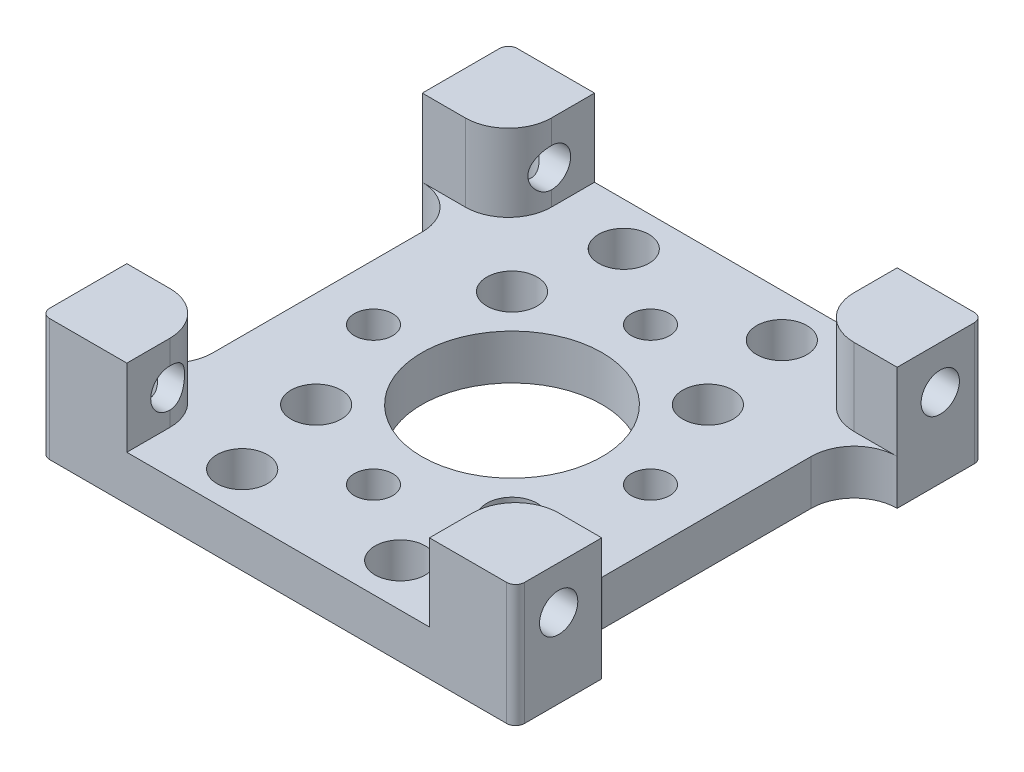
from build123d import *

# Parameters (mm, degrees)
SKETCH1_W                   = 33.528
SKETCH1_H                   = 33.02
BOSS_EXTRUDE1_DEPTH         = 3.175
CUT_EXTRUDE1_DEPTH          = 24.742207585
CUT_EXTRUDE2_DEPTH          = 24.742207585
SKETCH4_W                   = 6.08076
SKETCH4_H                   = 5.45338
BOSS_EXTRUDE2_DEPTH         = 6.08076
SKETCH5_W                   = 6.08076
SKETCH5_H                   = 5.45338
BOSS_EXTRUDE3_DEPTH         = 6.08076
SKETCH6_W                   = 6.08076
SKETCH6_H                   = 5.45338
BOSS_EXTRUDE4_DEPTH         = 6.08076
SKETCH7_W                   = 6.08076
SKETCH7_H                   = 5.45338
BOSS_EXTRUDE5_DEPTH         = 6.08076
HOLE1_D                     = 12.7254
M2_5_CLEARANCE_HOLE1_D      = 2.7051
M3_CLEARANCE_HOLE1_D        = 3.556
M2_5_CLEARANCE_HOLE2_D      = 2.7051
M2_5_CLEARANCE_HOLE2_DEPTH  = 39.60876
M2_5_CLEARANCE_HOLE3_D      = 2.7051
M2_5_CLEARANCE_HOLE3_DEPTH  = 39.60876
M2_5_CLEARANCE_HOLE4_REACH  = 27.061
M2_5_CLEARANCE_HOLE4_BORE_R = 1.35255
FILLET1_R                   = 0.635
FILLET2_R                   = 3.04038


with BuildPart() as part:
    # Sketch1 → Boss-Extrude1 (new body)
    with BuildSketch(Plane(origin=(0, 3.175, 0), x_dir=(1, 0, 0), z_dir=(0, 1, 0))):
        Rectangle(SKETCH1_W, SKETCH1_H)
    extrude(amount=-BOSS_EXTRUDE1_DEPTH)

    # Sketch2 → Cut-Extrude1 (cut, through all)
    with BuildSketch(Plane.XZ):
        with BuildLine():
            Line((16.764, -10.42924), (16.764, 10.42924))
            ThreePointArc((16.764, 10.42924), (14.617411383, 9.536940757), (13.7287, 7.388864244))
            Line((13.7287, 7.388864244), (13.7287, -7.388864244))
            ThreePointArc((13.7287, -7.388864244), (14.617411383, -9.536940757), (16.764, -10.42924))
        make_face()
    extrude(amount=-CUT_EXTRUDE1_DEPTH, mode=Mode.SUBTRACT)

    # Sketch3 → Cut-Extrude2 (cut, through all)
    with BuildSketch(Plane.XZ):
        with BuildLine():
            Line((-16.764, 10.42924), (-16.764, -10.42924))
            ThreePointArc((-16.764, -10.42924), (-14.617411383, -9.536940757), (-13.7287, -7.388864244))
            Line((-13.7287, -7.388864244), (-13.7287, 7.388864244))
            ThreePointArc((-13.7287, 7.388864244), (-14.617411383, 9.536940757), (-16.764, 10.42924))
        make_face()
    extrude(amount=-CUT_EXTRUDE2_DEPTH, mode=Mode.SUBTRACT)

    # Sketch4 → Boss-Extrude2 (add)
    with BuildSketch(Plane(origin=(0, 0, -16.51), x_dir=(-1, 0, 0), z_dir=(0, 0, -1))):
        with Locations((13.72362, 5.90169)):
            Rectangle(SKETCH4_W, SKETCH4_H)
    extrude(amount=-BOSS_EXTRUDE2_DEPTH)

    # Sketch5 → Boss-Extrude3 (add)
    with BuildSketch(Plane(origin=(0, 0, -16.51), x_dir=(-1, 0, 0), z_dir=(0, 0, -1))):
        with Locations((-13.72362, 5.90169)):
            Rectangle(SKETCH5_W, SKETCH5_H)
    extrude(amount=-BOSS_EXTRUDE3_DEPTH)

    # Sketch6 → Boss-Extrude4 (add)
    with BuildSketch(Plane.XY.offset(16.51)):
        with Locations((13.72362, 5.90169)):
            Rectangle(SKETCH6_W, SKETCH6_H)
    extrude(amount=-BOSS_EXTRUDE4_DEPTH)

    # Sketch7 → Boss-Extrude5 (add)
    with BuildSketch(Plane.XY.offset(16.51)):
        with Locations((-13.72362, 5.90169)):
            Rectangle(SKETCH7_W, SKETCH7_H)
    extrude(amount=-BOSS_EXTRUDE5_DEPTH)

    # Hole1 (through all)
    with Locations(Plane(origin=(0, 3.175, 0), x_dir=(1, 0, 0), z_dir=(0, 1, 0))):
        with Locations((0, 0)):
            Hole(HOLE1_D / 2)

    # M2.5 Clearance Hole1 (through all)
    with Locations(Plane(origin=(0, 3.175, 0), x_dir=(1, 0, 0), z_dir=(0, 1, 0))):
        with Locations((0, 9.779), (-9.779, 0), (0, -9.779), (9.779, 0)):
            Hole(M2_5_CLEARANCE_HOLE1_D / 2)

    # M3 Clearance Hole1 (through all)
    with Locations(Plane(origin=(0, 3.175, 0), x_dir=(1, 0, 0), z_dir=(0, 1, 0))):
        with Locations((-5.579615818, -13.470384182), (5.579615818, -13.470384182), (5.579615818, 13.470384182), (-5.579615818, 13.470384182), (6.914797213, 6.914797213), (-6.914797213, 6.914797213), (-6.914797213, -6.914797213), (6.914797213, -6.914797213)):
            Hole(M3_CLEARANCE_HOLE1_D / 2)

    # M2.5 Clearance Hole2
    with Locations(Plane(origin=(16.764, 0, 0), x_dir=(0, 0, -1), z_dir=(1, 0, 0))):
        with Locations((-13.470384182, 5.588)):
            Hole(M2_5_CLEARANCE_HOLE2_D / 2, depth=M2_5_CLEARANCE_HOLE2_DEPTH)

    # M2.5 Clearance Hole3
    with Locations(Plane.ZY.offset(16.764)):
        with Locations((-13.470384182, 5.588)):
            Hole(M2_5_CLEARANCE_HOLE3_D / 2, depth=M2_5_CLEARANCE_HOLE3_DEPTH)

    # M2.5 Clearance Hole4 bore → M2.5 Clearance Hole4 (cut, up to next)
    with BuildSketch(Plane(origin=(0, 0, 0), x_dir=(-1, 0, 0), z_dir=(0, -1, 0)), mode=Mode.PRIVATE) as m2_5_clearance_hole4_sk1:
        with Locations((13.470384182, 13.470384182)):
            Circle(M2_5_CLEARANCE_HOLE4_BORE_R)
    m2_5_clearance_hole4_tool1 = extrude(m2_5_clearance_hole4_sk1.sketch, amount=-M2_5_CLEARANCE_HOLE4_REACH, mode=Mode.PRIVATE) & part.part
    # M2.5 Clearance Hole4 bore → M2.5 Clearance Hole4 (cut, up to next)
    with BuildSketch(Plane(origin=(0, 0, 0), x_dir=(-1, 0, 0), z_dir=(0, -1, 0)), mode=Mode.PRIVATE) as m2_5_clearance_hole4_sk2:
        with Locations((-13.470384182, 13.470384182)):
            Circle(M2_5_CLEARANCE_HOLE4_BORE_R)
    m2_5_clearance_hole4_tool2 = extrude(m2_5_clearance_hole4_sk2.sketch, amount=-M2_5_CLEARANCE_HOLE4_REACH, mode=Mode.PRIVATE) & part.part
    # M2.5 Clearance Hole4 bore → M2.5 Clearance Hole4 (cut, up to next)
    with BuildSketch(Plane(origin=(0, 0, 0), x_dir=(-1, 0, 0), z_dir=(0, -1, 0)), mode=Mode.PRIVATE) as m2_5_clearance_hole4_sk3:
        with Locations((-13.470384182, -13.470384182)):
            Circle(M2_5_CLEARANCE_HOLE4_BORE_R)
    m2_5_clearance_hole4_tool3 = extrude(m2_5_clearance_hole4_sk3.sketch, amount=-M2_5_CLEARANCE_HOLE4_REACH, mode=Mode.PRIVATE) & part.part
    # M2.5 Clearance Hole4 bore → M2.5 Clearance Hole4 (cut, up to next)
    with BuildSketch(Plane(origin=(0, 0, 0), x_dir=(-1, 0, 0), z_dir=(0, -1, 0)), mode=Mode.PRIVATE) as m2_5_clearance_hole4_sk4:
        with Locations((13.470384182, -13.470384182)):
            Circle(M2_5_CLEARANCE_HOLE4_BORE_R)
    m2_5_clearance_hole4_tool4 = extrude(m2_5_clearance_hole4_sk4.sketch, amount=-M2_5_CLEARANCE_HOLE4_REACH, mode=Mode.PRIVATE) & part.part
    add(m2_5_clearance_hole4_tool1.solids().sort_by_distance((-13.470384, 0, -13.470384))[0], mode=Mode.SUBTRACT)
    add(m2_5_clearance_hole4_tool2.solids().sort_by_distance((13.470384, 0, -13.470384))[0], mode=Mode.SUBTRACT)
    add(m2_5_clearance_hole4_tool3.solids().sort_by_distance((13.470384, 0, 13.470384))[0], mode=Mode.SUBTRACT)
    add(m2_5_clearance_hole4_tool4.solids().sort_by_distance((-13.470384, 0, 13.470384))[0], mode=Mode.SUBTRACT)

    # Fillet1
    fillet1_edges = [part.edges().sort_by_distance(p)[0] for p in [
        (-16.764, 4.31419, 16.51),
        (-16.764, 4.31419, -16.51),
        (16.764, 4.31419, -16.51),
        (16.764, 4.31419, 16.51),
    ]]
    fillet(fillet1_edges, radius=FILLET1_R)

    # Fillet2
    # the kernel refuses this fillet: 3.04038 mm, written as the material it takes off along each edge
    with BuildSketch(Plane(origin=(-10.68324, 16.22933, -10.42924), x_dir=(-1, 0, 0), z_dir=(0, -1, 0)), Plane(origin=(10.68324, 16.22933, 10.42924), x_dir=(1, 0, 0), z_dir=(0, -1, 0)), Plane(origin=(-10.68324, 3.175, 10.42924), x_dir=(-1, 0, 0), z_dir=(0, 1, 0))) as fillet2_piece_1:
        with BuildLine():
            CenterArc((FILLET2_R, FILLET2_R), FILLET2_R, 180, 90)
            Line((0, FILLET2_R), (0, 0))
            Line((0, 0), (FILLET2_R, 0))
        make_face()
    extrude(amount=13.05433, mode=Mode.SUBTRACT)
    with BuildSketch(Plane(origin=(10.68324, 3.175, -10.42924), x_dir=(0, 0, -1), z_dir=(0, 1, 0))) as fillet2_piece_2:
        with BuildLine():
            CenterArc((FILLET2_R, -FILLET2_R), FILLET2_R, 90, 90)
            Line((0, -FILLET2_R), (0, 0))
            Line((0, 0), (FILLET2_R, 0))
        make_face()
    extrude(amount=13.05433, mode=Mode.SUBTRACT)


solid = part.part
